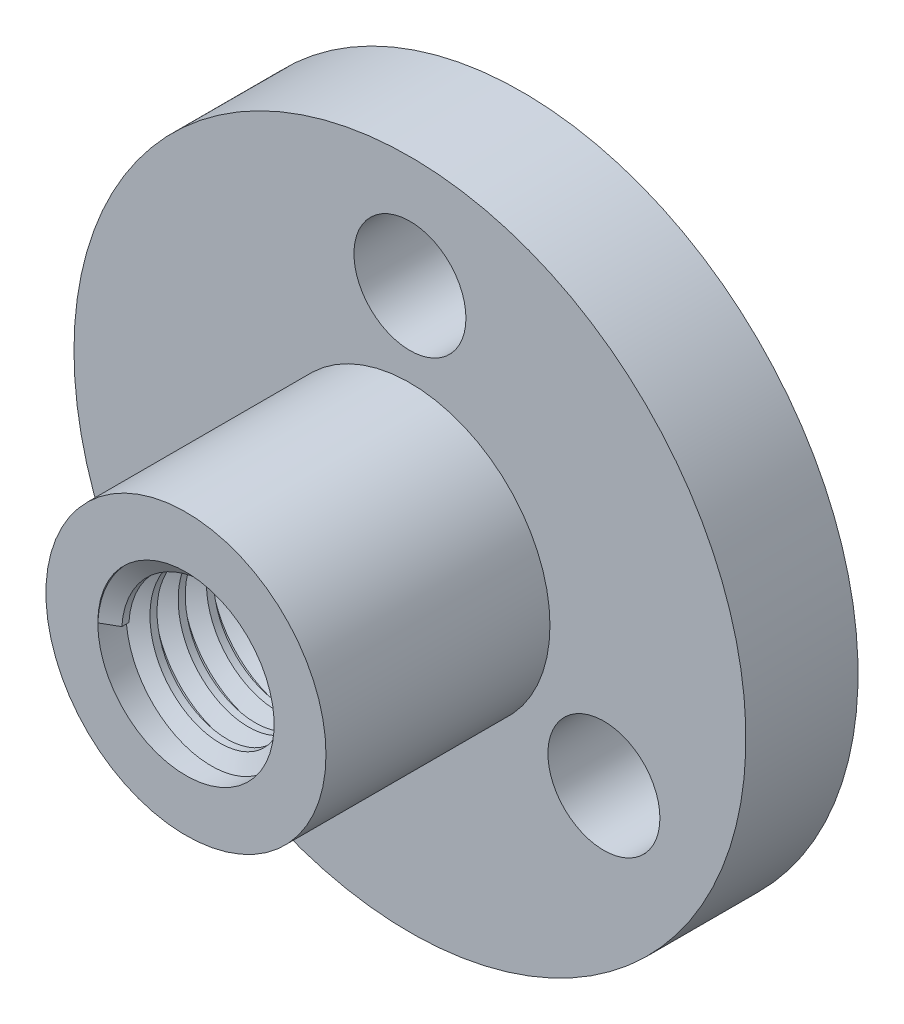
from build123d import *

# Parameters (mm, degrees)
SKETCH1_R           = 9.525
BOSS_EXTRUDE1_DEPTH = 3.18
SKETCH2_R           = 3.97
BOSS_EXTRUDE2_DEPTH = 6.35
SKETCH3_R           = 2.5
CUT_EXTRUDE1_DEPTH  = 9.53
SKETCH4_R           = 1.5875
CUT_EXTRUDE2_DEPTH  = 3.18
CIRPATTERN1_COUNT   = 3
THREAD1_PITCH       = 0.8
THREAD1_TO          = 9.53


with BuildPart() as part:
    # Sketch1 → Boss-Extrude1 (new body)
    with BuildSketch(Plane.XY):
        with Locations(Location((0, 0, 0), (0, 0, 180))):
            Circle(SKETCH1_R)
    extrude(amount=BOSS_EXTRUDE1_DEPTH)

    # Sketch2 → Boss-Extrude2 (add)
    with BuildSketch(Plane.XY.offset(3.18)):
        Circle(SKETCH2_R)
    extrude(amount=BOSS_EXTRUDE2_DEPTH)

    # Sketch3 → Cut-Extrude1 (cut)
    with BuildSketch(Plane.XY.offset(9.53)):
        Circle(SKETCH3_R)
    extrude(amount=-CUT_EXTRUDE1_DEPTH, mode=Mode.SUBTRACT)

    # Sketch4 → Cut-Extrude2 (cut)
    with BuildSketch(Plane.XY.offset(3.18)):
        with Locations((0, 6.35)):
            Circle(SKETCH4_R)
    cut_extrude2 = extrude(amount=-CUT_EXTRUDE2_DEPTH, mode=Mode.SUBTRACT)

    # CirPattern1: Cut-Extrude2 ×3 about axis
    cirpattern1_axis = Axis((0, 0, 0), (0, 0, 1))
    for i in range(1, CIRPATTERN1_COUNT):
        add(cut_extrude2.rotate(cirpattern1_axis, i * 360 / CIRPATTERN1_COUNT), mode=Mode.SUBTRACT)

    # Thread1: arcs per turn and ends read off the stored shape
    # Thread1: the profile of Thread Profile1 profile screwed along a right-hand helix through 11.9125 turns, 8 arcs to a turn; built about Z, then put on its axis
    thread1_z = Axis((0, 0, 0), (0, 0, 1))
    thread1_corners = [(2.5003, 0, -0.000173), (2.5003, 0, 0.700173), (2.066987, 0, 0.45), (2.066987, 0, 0.25)]
    with BuildLine(mode=Mode.PRIVATE) as thread1_profile:
        Line(thread1_corners[0], thread1_corners[1])
        Line(thread1_corners[1], thread1_corners[2])
        Line(thread1_corners[2], thread1_corners[3])
        Line(thread1_corners[3], thread1_corners[0])
    thread1_cap = Face(thread1_profile.wire())
    thread1_turn_angles = [0, 22.5, 45, 67.5, 90, 112.5, 135, 157.5, 180, 202.5, 225, 247.5, 270, 292.5, 315, 337.5, 360]
    thread1_turn_weights = [1, 0.9238795325112867, 1, 0.9238795325112867, 1, 0.9238795325112867, 1, 0.9238795325112867, 1, 0.9238795325112867, 1, 0.9238795325112867, 1, 0.9238795325112867, 1, 0.9238795325112867, 1]
    thread1_turn_rails = [Edge.make_bspline([Vector(p[0], p[1], 0).rotate(thread1_z, thread1_turn_angles[k]) / thread1_turn_weights[k] + Vector(0, 0, p[2] + THREAD1_PITCH * thread1_turn_angles[k] / 360) for k in range(17)], [0, 0, 0, 1, 1, 2, 2, 3, 3, 4, 4, 5, 5, 6, 6, 7, 7, 8, 8, 8], 2, thread1_turn_weights) for p in thread1_corners]
    thread1_turn_sides = [Face.make_surface_from_curves(thread1_turn_rails[p[0]], thread1_turn_rails[p[1]]) for p in [(0, 1), (1, 2), (2, 3), (3, 0)]]
    thread1_last_angles = [3960, 3982.5, 4005, 4027.5, 4050, 4072.5, 4095, 4117.5, 4140, 4162.5, 4185, 4207.5, 4230, 4252.5, 4275, 4281.75, 4288.5]
    thread1_last_weights = [1, 0.9238795325112867, 1, 0.9238795325112867, 1, 0.9238795325112867, 1, 0.9238795325112867, 1, 0.9238795325112867, 1, 0.9238795325112867, 1, 0.9238795325112867, 1, 0.9930684569549263, 1]
    thread1_last_rails = [Edge.make_bspline([Vector(p[0], p[1], 0).rotate(thread1_z, thread1_last_angles[k]) / thread1_last_weights[k] + Vector(0, 0, p[2] + THREAD1_PITCH * thread1_last_angles[k] / 360) for k in range(17)], [0, 0, 0, 1, 1, 2, 2, 3, 3, 4, 4, 5, 5, 6, 6, 7, 7, 8, 8, 8], 2, thread1_last_weights) for p in thread1_corners]
    thread1_last_sides = [Face.make_surface_from_curves(thread1_last_rails[p[0]], thread1_last_rails[p[1]]) for p in [(0, 1), (1, 2), (2, 3), (3, 0)]]
    thread1 = Plane(origin=(0, 0, 9.53), x_dir=(-1, 0, 0), z_dir=(0, 0, -1)) * split(Solid(Shell([*[p.moved(Location((0, 0, THREAD1_PITCH * i))) for i in range(11) for p in thread1_turn_sides], *thread1_last_sides, thread1_cap, thread1_cap.rotate(thread1_z, 4288.5).moved(Location((0, 0, THREAD1_PITCH * 4288.5 / 360)))])), bisect_by=Plane.XY.offset(THREAD1_TO), keep=Keep.BOTTOM, mode=Mode.PRIVATE)
    add(thread1)


solid = part.part
